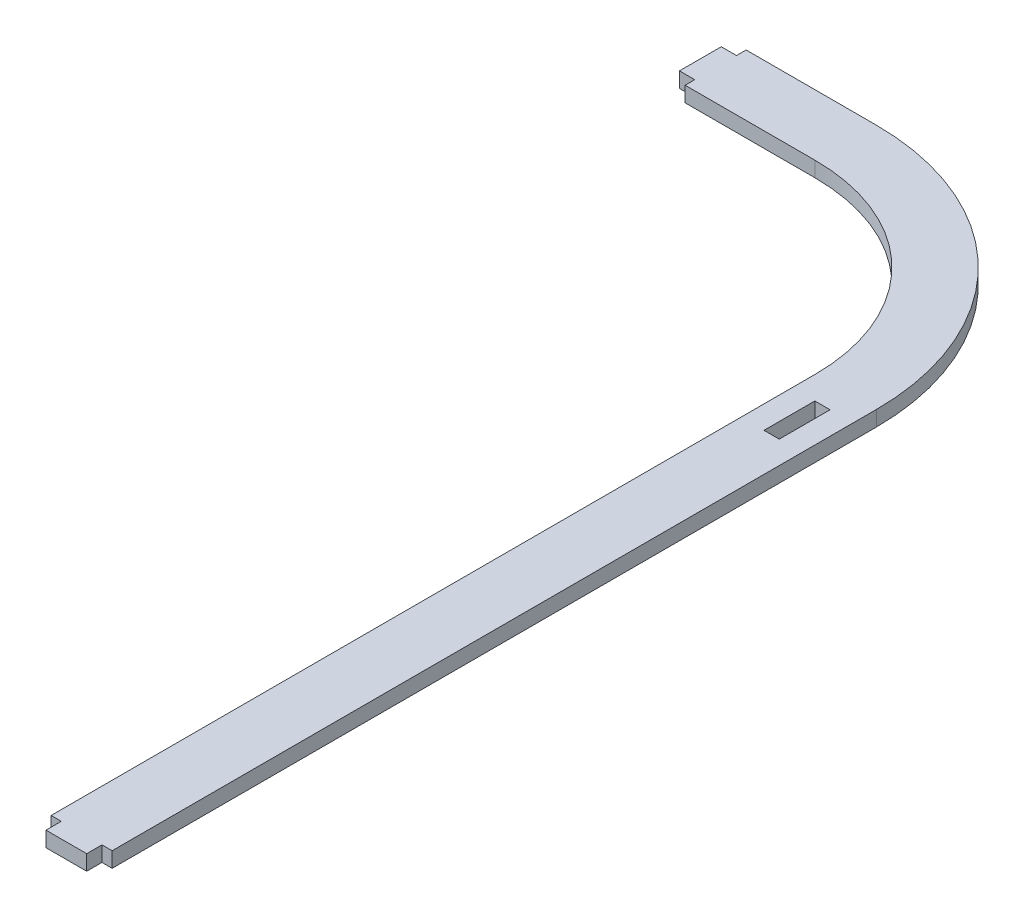
from build123d import *

# Parameters (mm, degrees)
SALIENTE_EXTRUIR1_DEPTH = 3
CORTAR_EXTRUIR1_DEPTH   = 10


with BuildPart() as part:
    # Croquis1 → Saliente-Extruir1 (new body)
    with BuildSketch(Plane(origin=(0, 0, 0), x_dir=(1, 0, 0), z_dir=(0, 1, 0))):
        with BuildLine():
            Line((0, 7.786096257), (0, 0))
            Line((0, 0), (0, -0.213903743))
            Line((0, -0.213903743), (3, -0.213903743))
            Line((3, -0.213903743), (3, -2.106951872))
            Line((3, -2.106951872), (7.35828877, -2.106951872))
            Line((7.35828877, -2.106951872), (28.573593129, -2.106951872))
            ThreePointArc((28.573593129, -2.106951872), (54.330952442, -12.77599943), (65, -38.533358743))
            Line((65, -38.533358743), (65, -117.736951872))
            Line((65, -117.736951872), (65, -188.736951872))
            Line((65, -188.736951872), (67, -188.736951872))
            Line((67, -188.736951872), (67, -191.736951872))
            Line((67, -191.736951872), (75, -191.736951872))
            Line((75, -191.736951872), (75, -188.736951872))
            Line((75, -188.736951872), (77, -188.736951872))
            Line((77, -188.736951872), (77, -38.533358743))
            ThreePointArc((77, -38.533358743), (62.816233816, -4.290718056), (28.573593129, 9.893048128))
            Line((28.573593129, 9.893048128), (3, 9.893048128))
            Line((3, 9.893048128), (3, 8))
            Line((3, 8), (0, 8))
            Line((0, 8), (0, 7.786096257))
        make_face()
    extrude(amount=SALIENTE_EXTRUIR1_DEPTH)

    # Croquis2 → Cortar-Extruir1 (cut)
    with BuildSketch(Plane(origin=(0, 3, 0), x_dir=(1, 0, 0), z_dir=(0, 1, 0))):
        Polygon((69.5, -48.106951872), (69.5, -43.106951872), (72.5, -43.106951872), (72.5, -53.106951872), (69.5, -53.106951872), align=None)
    extrude(amount=-CORTAR_EXTRUIR1_DEPTH, mode=Mode.SUBTRACT)


solid = part.part
